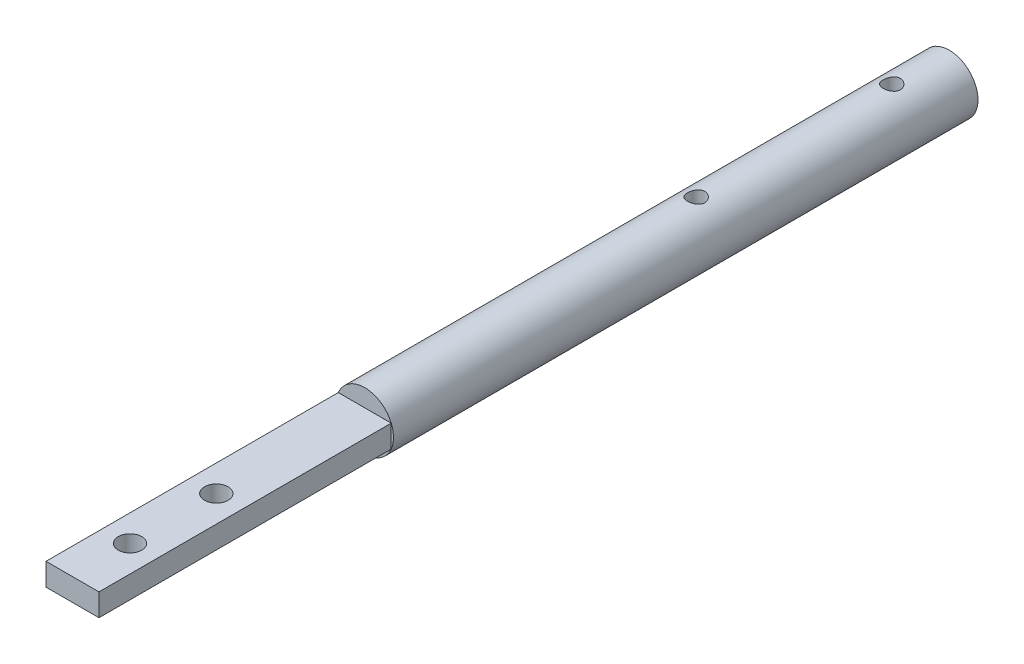
from build123d import *

# Parameters (mm, degrees)
SKETCH1_R               = 2.5
BOSS_EXTRUDE1_DEPTH     = 50.8
SKETCH2_W               = 4.604836256
SKETCH2_H               = 1.948199954
BOSS_EXTRUDE2_DEPTH     = 25.4
SKETCH3_R               = 1.022717979
CUT_EXTRUDE1_DEPTH      = 77.320111181
CUT_EXTRUDE2_DEPTH      = 77.281976901
CUT_EXTRUDE2_DEPTH_BACK = 77.281976901
SKETCH4_R               = 0.75


with BuildPart() as part:
    # Sketch1 → Boss-Extrude1 (new body)
    with BuildSketch(Plane.XY):
        Circle(SKETCH1_R)
    extrude(amount=BOSS_EXTRUDE1_DEPTH)

    # Sketch2 → Boss-Extrude2 (add)
    with BuildSketch(Plane.XY.offset(50.8)):
        Rectangle(SKETCH2_W, SKETCH2_H)
    extrude(amount=BOSS_EXTRUDE2_DEPTH)

    # Sketch3 → Cut-Extrude1 (cut, through all)
    with BuildSketch(Plane(origin=(0, 0.974099977, 0), x_dir=(1, 0, 0), z_dir=(0, 1, 0))):
        with Locations((0, -63.7)):
            Circle(SKETCH3_R)
        with Locations((0, -71.2)):
            Circle(SKETCH3_R)
    extrude(amount=-CUT_EXTRUDE1_DEPTH, mode=Mode.SUBTRACT)

    # Sketch4 → Cut-Extrude2 (cut, two sides: drawn at the far end of the back side and taken through both)
    with BuildSketch(Plane(origin=(0, 0, 0), x_dir=(1, 0, 0), z_dir=(0, 1, 0)).offset(-CUT_EXTRUDE2_DEPTH_BACK)):
        with Locations((0, -5)):
            Circle(SKETCH4_R)
        with Locations((0, -22)):
            Circle(SKETCH4_R)
    extrude(amount=CUT_EXTRUDE2_DEPTH + CUT_EXTRUDE2_DEPTH_BACK, mode=Mode.SUBTRACT)


solid = part.part
